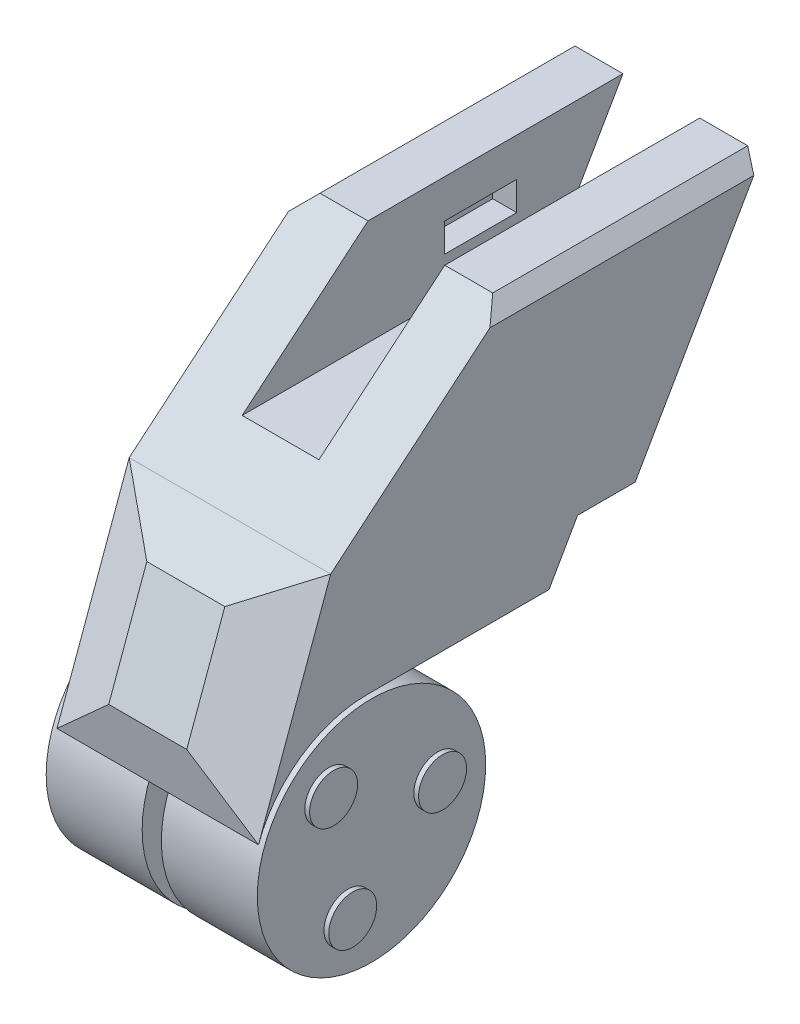
from build123d import *
from OCP.BRepFilletAPI import BRepFilletAPI_MakeChamfer

# Parameters (mm, degrees)
BOSS_EXTRUDE1_START = 1
SKETCH1_R           = 11.9
BOSS_EXTRUDE1_DEPTH = 10
BOSS_EXTRUDE2_START = -1
SKETCH1_2_R         = 11.9
BOSS_EXTRUDE2_DEPTH = 10
SKETCH2_R           = 6
CUT_EXTRUDE1_DEPTH  = 4
BOSS_EXTRUDE3_DEPTH = 10.5
SKETCH4_W           = 21
SKETCH4_H           = 22
BOSS_EXTRUDE4_DEPTH = 3
CHAMFER1_SIZE       = 5.196152423
CHAMFER1_SIZE_2     = 3
CHAMFER2_SIZE       = 3
CHAMFER2_SIZE2      = 6.433520762
SKETCH5_R           = 2.5
BOSS_EXTRUDE5_DEPTH = 0.5
SKETCH7_W           = 8
SKETCH7_H           = 11
CUT_EXTRUDE2_DEPTH  = 59.705665531
CHAMFER3_SIZE       = 1.5
SCALE2_SCALE        = 2
SKETCH9_W           = 15
SKETCH9_H           = 6
CUT_EXTRUDE3_DEPTH  = 5


with BuildPart() as part:
    # Sketch1 → Boss-Extrude1 (new body)
    with BuildSketch(Plane(origin=(0, 0, 0), x_dir=(0, 0, -1), z_dir=(1, 0, 0)).offset(BOSS_EXTRUDE1_START)):
        Circle(SKETCH1_R)
    extrude(amount=BOSS_EXTRUDE1_DEPTH)


with BuildPart() as body_2:
    # Sketch1<2> → Boss-Extrude2 (new body)
    with BuildSketch(Plane(origin=(0, 0, 0), x_dir=(0, 0, -1), z_dir=(1, 0, 0)).offset(BOSS_EXTRUDE2_START)):
        Circle(SKETCH1_2_R)
    extrude(amount=-BOSS_EXTRUDE2_DEPTH)

    # Sketch2 → Cut-Extrude1 (cut)
    with BuildSketch(Plane(origin=(-1, 0, 0), x_dir=(0, 0, -1), z_dir=(1, 0, 0))):
        Circle(SKETCH2_R)
    cut_extrude1 = extrude(amount=-CUT_EXTRUDE1_DEPTH, mode=Mode.SUBTRACT)


with BuildPart() as part_1:
    add(part.part)

    # Mirror1: Cut-Extrude1 across plane
    add(cut_extrude1.mirror(Plane(origin=(0, 0, 0), x_dir=(0, 0, 1), z_dir=(1, 0, 0))), mode=Mode.SUBTRACT)

    # Sketch5 → Boss-Extrude5 (add)
    with BuildSketch(Plane(origin=(11, 0, 0), x_dir=(0, 0, -1), z_dir=(1, 0, 0))):
        with Locations((-4.449139328, 5.404179793)):
            Circle(SKETCH5_R)
        with Locations((6.904726652, 1.150977786)):
            Circle(SKETCH5_R)
        with Locations((-2.455587324, -6.55515758)):
            Circle(SKETCH5_R)
    boss_extrude5 = extrude(amount=BOSS_EXTRUDE5_DEPTH)


with BuildPart() as body_3:
    # Sketch3 → Boss-Extrude3 (new, symmetric)
    with BuildSketch(Plane(origin=(0, 0, 0), x_dir=(0, 0, -1), z_dir=(1, 0, 0))):
        with BuildLine():
            Line((0, 12), (19, 12))
            Line((19, 12), (21.974680573, 17.210688581))
            Line((21.974680573, 17.210688581), (27.974680573, 17.210688581))
            Line((27.974680573, 17.210688581), (41.203310943, 40.20438201))
            Line((41.203310943, 40.20438201), (14.633198339, 40.20438201))
            Line((14.633198339, 40.20438201), (-3.751868296, 24.777479377))
            Line((-3.751868296, 24.777479377), (-11.276311449, 4.10424172))
            ThreePointArc((-11.276311449, 4.10424172), (-6.882917236, 9.829824531), (0, 12))
        make_face()
    extrude(amount=BOSS_EXTRUDE3_DEPTH, both=True)

    # Sketch4 → Boss-Extrude4 (add)
    with BuildSketch(Plane(origin=(0, 4.10424172, 11.276311449), x_dir=(1, 0, 0), z_dir=(0, 0.34202014332566527, 0.9396926207859096))):
        with Locations((0, 11)):
            Rectangle(SKETCH4_W, SKETCH4_H)
    extrude(amount=BOSS_EXTRUDE4_DEPTH)

    # Chamfer1
    chamfer1_edges_1 = [body_3.edges().sort_by_distance(p)[0] for p in [
        (0, 25.803539807, 6.570946159),
    ]]
    chamfer1_side_1 = [body_3.faces().sort_by_distance(p)[0] for p in [
        (0, 25.74715825, 6.591467367),
    ]]
    chamfer1_edges_2 = [body_3.edges().sort_by_distance(p)[0] for p in [
        (0, 5.13030215, 14.095389312),
    ]]
    chamfer1_side_2 = [body_3.faces().sort_by_distance(p)[0] for p in [
        (0, 5.109780941, 14.039007755),
    ]]
    chamfer1 = BRepFilletAPI_MakeChamfer(body_3.part.solid().wrapped)
    for e in chamfer1_edges_1:
        chamfer1.Add(CHAMFER1_SIZE - 0.0001, CHAMFER1_SIZE_2 - 0.0001, e.wrapped, chamfer1_side_1[0].wrapped)
    for e in chamfer1_edges_2:
        chamfer1.Add(CHAMFER1_SIZE_2 - 0.0001, CHAMFER1_SIZE - 0.0001, e.wrapped, chamfer1_side_2[0].wrapped)
    add(Compound.cast(chamfer1.Shape()), mode=Mode.REPLACE)  # a hair under: the kernel refuses the full size

    # Chamfer2: one chamfer whose edges measure the first distance from different faces: ONE call of the kernel's chamfer builder (chamfer() names one face for all edges)
    chamfer2_edges_1 = [body_3.edges().sort_by_distance(p)[0] for p in [
        (10.5, 15.466920979, 10.333167735),
    ]]
    chamfer2_side_1 = [body_3.faces().sort_by_distance(p)[0] for p in [
        (10.5, 25.167414296, -14.377800232),
    ]]
    chamfer2_edges_2 = [body_3.edges().sort_by_distance(p)[0] for p in [
        (-10.5, 15.466920979, 10.333167735),
    ]]
    chamfer2_side_2 = [body_3.faces().sort_by_distance(p)[0] for p in [
        (-10.5, 25.167414296, -14.377800232),
    ]]
    chamfer2 = BRepFilletAPI_MakeChamfer(body_3.part.solid().wrapped)
    for e in chamfer2_edges_1:
        chamfer2.Add(CHAMFER2_SIZE, CHAMFER2_SIZE2, e.wrapped, chamfer2_side_1[0].wrapped)  # the first distance lies on this face
    for e in chamfer2_edges_2:
        chamfer2.Add(CHAMFER2_SIZE, CHAMFER2_SIZE2, e.wrapped, chamfer2_side_2[0].wrapped)  # the first distance lies on this face
    add(Compound.cast(chamfer2.Shape()), mode=Mode.REPLACE)

    # Sketch7 → Cut-Extrude2 (cut, through all)
    with BuildSketch(Plane.XY):
        with Locations((0, 34.70438201)):
            Rectangle(SKETCH7_W, SKETCH7_H)
    extrude(amount=-CUT_EXTRUDE2_DEPTH, mode=Mode.SUBTRACT)

    # Chamfer3
    chamfer3_edges = [body_3.edges().sort_by_distance(p)[0] for p in [
        (10.5, 40.20438201, -27.918254641),
        (-10.5, 40.20438201, -27.918254641),
    ]]
    chamfer(chamfer3_edges, length=CHAMFER3_SIZE)


with BuildPart() as body_2_1:
    add(body_2.part)

    # Mirror2: Boss-Extrude5 across plane
    add(boss_extrude5.mirror(Plane(origin=(0, 0, 0), x_dir=(0, 0, 1), z_dir=(1, 0, 0))))


with BuildPart() as body_2_2:
    # Scale2: scaled about (0, 0, 0)
    add(body_2_1.part.scale(SCALE2_SCALE))


with BuildPart() as body_3_1:
    # Scale2: scaled about (0, 0, 0)
    add(body_3.part.scale(SCALE2_SCALE))

    # Sketch9 → Cut-Extrude3 (cut)
    with BuildSketch(Plane(origin=(-8, 0, 0), x_dir=(0, 0, -1), z_dir=(1, 0, 0))):
        with Locations((52.766396677, 69.408764019)):
            Rectangle(SKETCH9_W, SKETCH9_H)
    cut_extrude3 = extrude(amount=-CUT_EXTRUDE3_DEPTH, mode=Mode.SUBTRACT)

    # Mirror3: Cut-Extrude3 across plane
    add(cut_extrude3.mirror(Plane(origin=(0, 0, 0), x_dir=(0, 0, 1), z_dir=(1, 0, 0))), mode=Mode.SUBTRACT)


with BuildPart() as part_2:
    # Scale2: scaled about (0, 0, 0)
    add(part_1.part.scale(SCALE2_SCALE))


solid = Compound([body_2_2.part, body_3_1.part, part_2.part])
